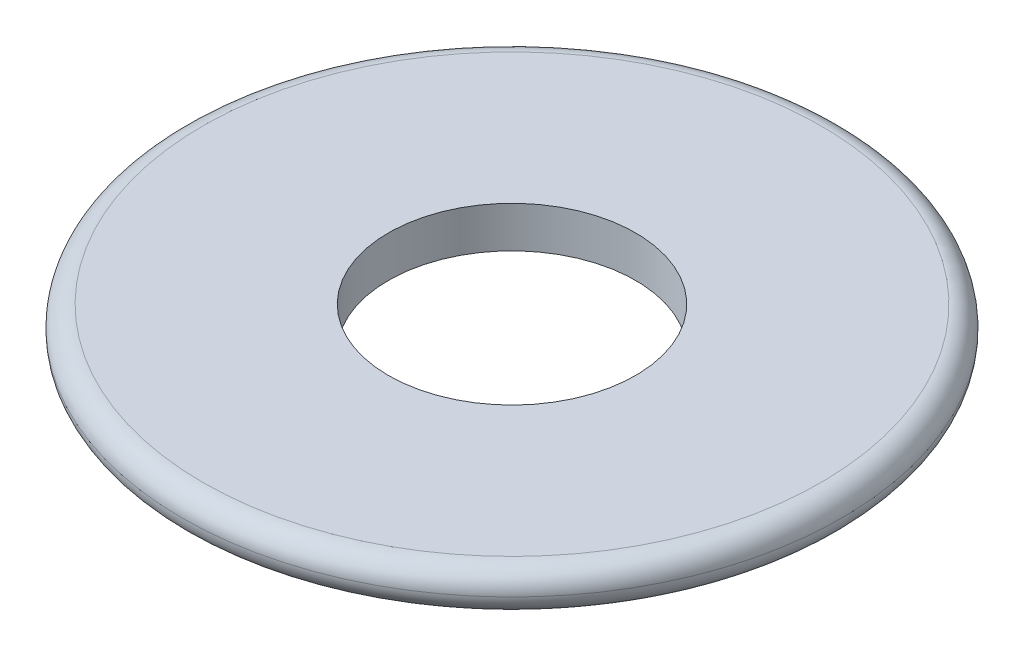
from build123d import *

# Parameters (mm, degrees)
SKETCH_1_R      = 8
SKETCH_1_R_2    = 3
EXTRUDE_1_DEPTH = 0.5
FILLET_1_R      = 0.5


with BuildPart() as part:
    # 草图1 → 凸台-拉伸1 (new, symmetric)
    with BuildSketch(Plane(origin=(0, 0, 0), x_dir=(1, 0, 0), z_dir=(0, 1, 0))):
        with Locations(Location((0, 0, 0), (0, 0, 270))):
            Circle(SKETCH_1_R)
        with Locations(Location((0, 0, 0), (0, 0, 270))):
            Circle(SKETCH_1_R_2, mode=Mode.SUBTRACT)
    extrude(amount=EXTRUDE_1_DEPTH, both=True)

    # 圆角1
    fillet_1_edges = [part.edges().sort_by_distance(p)[0] for p in [
        (0, -0.5, -8),
        (0, 0.5, -8),
    ]]
    fillet(fillet_1_edges, radius=FILLET_1_R - 0.0001)  # a hair under: the kernel refuses the full size


solid = part.part
